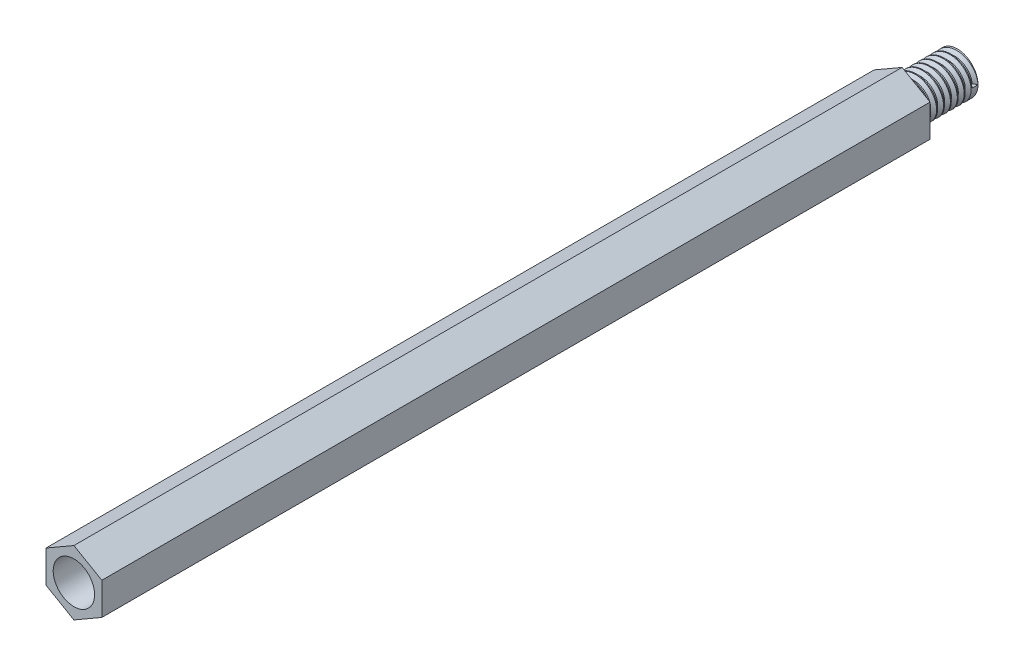
from build123d import *

# Parameters (mm, degrees)
SKETCH_1_R          = 2.335
SKETCH_1_R_2        = 1.5
EXTRUDE_1_DEPTH     = 60
SKETCH_3_OUTSIDE_W  = 18.742
SKETCH_3_OUTSIDE_H  = 18.742
CUT_EXTRUDE_2_DEPTH = 60
SKETCH_5_R          = 1.5
EXTRUDE_2_DEPTH     = 4
THREAD_1_PITCH      = 0.5


with BuildPart() as part:
    # Sketch 1 → 凸台-拉伸1 (new body)
    with BuildSketch(Plane.XY):
        Circle(SKETCH_1_R)
        Circle(SKETCH_1_R_2, mode=Mode.SUBTRACT)
    extrude(amount=EXTRUDE_1_DEPTH)

    # 草图3 outside → 切除-拉伸2 (cut)
    with BuildSketch(Plane.XY):
        Rectangle(SKETCH_3_OUTSIDE_W, SKETCH_3_OUTSIDE_H)
        Polygon((0, 2.335), (-2.022169318, 1.1675), (-2.022169318, -1.1675), (0, -2.335), (2.022169318, -1.1675), (2.022169318, 1.1675), align=None, mode=Mode.SUBTRACT)
    extrude(amount=CUT_EXTRUDE_2_DEPTH, mode=Mode.SUBTRACT)


with BuildPart() as body_2:
    # 草图5 → 凸台-拉伸2 (new body)
    with BuildSketch(Plane.XY):
        Circle(SKETCH_5_R)
    extrude(amount=-EXTRUDE_2_DEPTH)

    # 螺纹线1: the profile of Sketch 1 2 profile screwed along a right-hand helix of 8 turns, 6 arcs to a turn; built about Z, then put on its axis
    thread_1_z = Axis((0, 0, 0), (0, 0, 1))
    thread_1_corners = [(1.5003, 0, -0.000173205), (1.5003, 0, 0.437673204), (1.229367063, 0, 0.281249999), (1.229367063, 0, 0.156249999)]
    with BuildLine(mode=Mode.PRIVATE) as thread_1_profile:
        Line(thread_1_corners[0], thread_1_corners[1])
        Line(thread_1_corners[1], thread_1_corners[2])
        Line(thread_1_corners[2], thread_1_corners[3])
        Line(thread_1_corners[3], thread_1_corners[0])
    thread_1_cap = Face(thread_1_profile.wire())
    thread_1_turn_angles = [0, 30, 60, 90, 120, 150, 180, 210, 240, 270, 300, 330, 360]
    thread_1_turn_weights = [1, 0.8660254037844387, 1, 0.8660254037844387, 1, 0.8660254037844387, 1, 0.8660254037844387, 1, 0.8660254037844387, 1, 0.8660254037844387, 1]
    thread_1_turn_rails = [Edge.make_bspline([Vector(p[0], p[1], 0).rotate(thread_1_z, thread_1_turn_angles[k]) / thread_1_turn_weights[k] + Vector(0, 0, p[2] + THREAD_1_PITCH * thread_1_turn_angles[k] / 360) for k in range(13)], [0, 0, 0, 1, 1, 2, 2, 3, 3, 4, 4, 5, 5, 6, 6, 6], 2, thread_1_turn_weights) for p in thread_1_corners]
    thread_1_turn_sides = [Face.make_surface_from_curves(thread_1_turn_rails[p[0]], thread_1_turn_rails[p[1]]) for p in [(0, 1), (1, 2), (2, 3), (3, 0)]]
    thread_1 = Plane(origin=(0, 0, -4), x_dir=(1, 0, 0), z_dir=(0, 0, 1)) * Solid(Shell([*[p.moved(Location((0, 0, THREAD_1_PITCH * i))) for i in range(8) for p in thread_1_turn_sides], thread_1_cap, thread_1_cap.rotate(thread_1_z, 2880).moved(Location((0, 0, THREAD_1_PITCH * 2880 / 360)))]))
    add(thread_1, mode=Mode.SUBTRACT)


solid = Compound([part.part, body_2.part])
